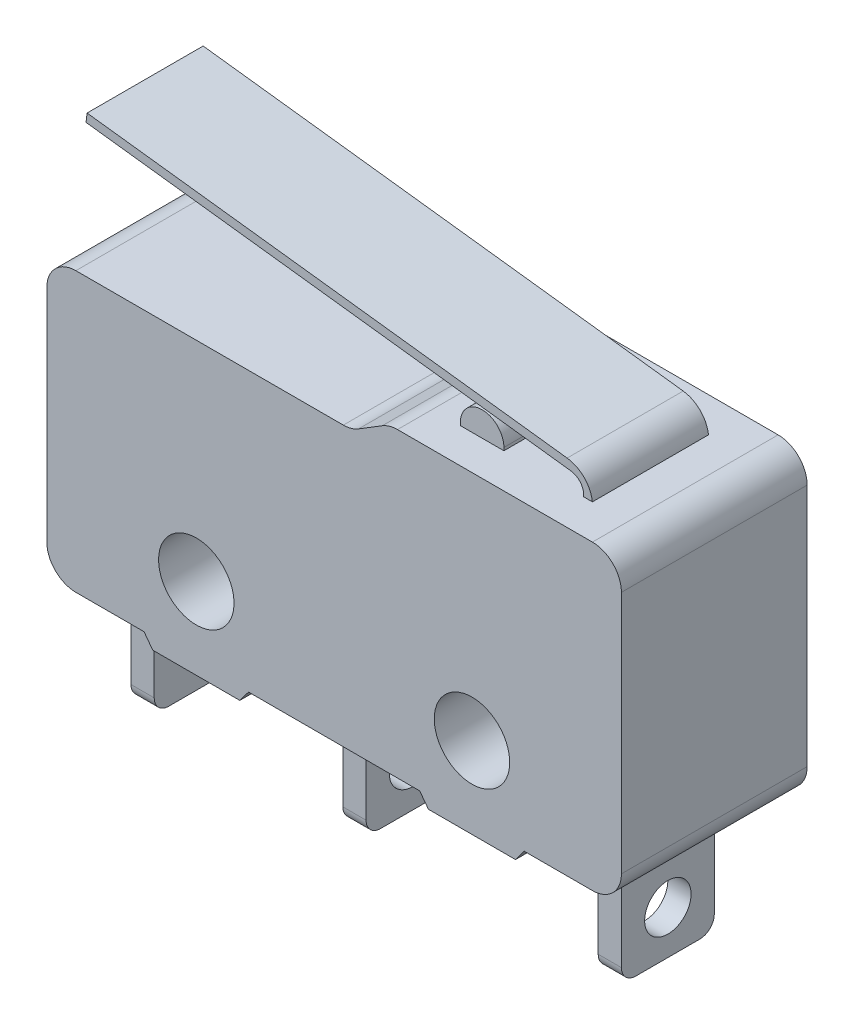
from build123d import *

# Parameters (mm, degrees)
SKETCH_1_W          = 19.8
SKETCH_1_H          = 10.4
EXTRUDE_1_DEPTH     = 6.4
SKETCH_2_R          = 1.3
CUT_EXTRUDE_1_DEPTH = 13.884486796
EXTRUDE_2_DEPTH     = 0.8
EXTRUDE_3_DEPTH     = 0.8
EXTRUDE_4_DEPTH     = 0.8
SKETCH_8_R          = 0.8
CUT_EXTRUDE_3_DEPTH = 22.33096341
CUT_EXTRUDE_4_DEPTH = 15.892279879
FILLET_3_R          = 1
EXTRUDE_5_DEPTH     = 4
EXTRUDE_10_DEPTH    = 4
FILLET_4_R          = 0.5
FILLET_5_R          = 1
FILLET_6_R          = 1
FILLET_7_R          = 1
EXTRUDE_11_DEPTH    = 6.4


with BuildPart() as part:
    # 草图1 → 凸台-拉伸1 (new body)
    with BuildSketch(Plane.XY):
        Rectangle(SKETCH_1_W, SKETCH_1_H)
    extrude(amount=EXTRUDE_1_DEPTH)

    # 草图2 → 切除-拉伸1 (cut, through all)
    with BuildSketch(Plane(origin=(0, 0, 0), x_dir=(-1, 0, 0), z_dir=(0, 0, -1))):
        with Locations((-4.75, -2.8)):
            Circle(SKETCH_2_R)
        with Locations((4.75, -2.8)):
            Circle(SKETCH_2_R)
    extrude(amount=-CUT_EXTRUDE_1_DEPTH, mode=Mode.SUBTRACT)

    # 草图5 → 凸台-拉伸2 (add)
    with BuildSketch(Plane(origin=(8.3, 0, 0), x_dir=(0, 0, -1), z_dir=(1, 0, 0))):
        with BuildLine():
            Line((-4.8, -5.2), (-1.6, -5.2))
            Line((-1.6, -5.2), (-1.6, -8.6))
            ThreePointArc((-1.6, -8.6), (-1.746446609, -8.953553391), (-2.1, -9.1))
            Line((-2.1, -9.1), (-4.3, -9.1))
            ThreePointArc((-4.3, -9.1), (-4.653553391, -8.953553391), (-4.8, -8.6))
            Line((-4.8, -8.6), (-4.8, -5.2))
        make_face()
    extrude(amount=-EXTRUDE_2_DEPTH)

    # 草图6 → 凸台-拉伸3 (add)
    with BuildSketch(Plane(origin=(-0.5, 0, 0), x_dir=(0, 0, -1), z_dir=(1, 0, 0))):
        with BuildLine():
            Line((-4.8, -5.2), (-1.6, -5.2))
            Line((-1.6, -5.2), (-1.6, -8.6))
            ThreePointArc((-1.6, -8.6), (-1.746446609, -8.953553391), (-2.1, -9.1))
            Line((-2.1, -9.1), (-4.3, -9.1))
            ThreePointArc((-4.3, -9.1), (-4.653553391, -8.953553391), (-4.8, -8.6))
            Line((-4.8, -8.6), (-4.8, -5.2))
        make_face()
    extrude(amount=-EXTRUDE_3_DEPTH)

    # 草图7 → 凸台-拉伸4 (add)
    with BuildSketch(Plane(origin=(-7.8, 0, 0), x_dir=(0, 0, -1), z_dir=(1, 0, 0))):
        with BuildLine():
            Line((-4.8, -5.2), (-1.6, -5.2))
            Line((-1.6, -5.2), (-1.6, -8.6))
            ThreePointArc((-1.6, -8.6), (-1.746446609, -8.953553391), (-2.1, -9.1))
            Line((-2.1, -9.1), (-4.3, -9.1))
            ThreePointArc((-4.3, -9.1), (-4.653553391, -8.953553391), (-4.8, -8.6))
            Line((-4.8, -8.6), (-4.8, -5.2))
        make_face()
    extrude(amount=-EXTRUDE_4_DEPTH)

    # 草图8 → 切除-拉伸3 (cut, through all)
    with BuildSketch(Plane(origin=(8.3, 0, 0), x_dir=(0, 0, -1), z_dir=(1, 0, 0))):
        with Locations(Location((-3.2, -7.6, 0), (0, 0, 180))):
            Circle(SKETCH_8_R)
    extrude(amount=-CUT_EXTRUDE_3_DEPTH, mode=Mode.SUBTRACT)

    # 草图9 → 切除-拉伸4 (cut, through all)
    with BuildSketch(Plane(origin=(0, 0, 0), x_dir=(-1, 0, 0), z_dir=(0, 0, -1))):
        Polygon((-1.9, 5.2), (-0.6, 4.4), (9.9, 4.4), (9.9, 5.2), align=None)
    extrude(amount=-CUT_EXTRUDE_4_DEPTH, mode=Mode.SUBTRACT)

    # 圆角3
    fillet_3_edges = [part.edges().sort_by_distance(p)[0] for p in [
        (1.9, 5.2, 3.2),
        (0.6, 4.4, 3.2),
    ]]
    fillet(fillet_3_edges, radius=FILLET_3_R)

    # 草图10 → 凸台-拉伸5 (add)
    with BuildSketch(Plane.XY.offset(1.2)):
        with BuildLine():
            Line((3.15, 5.2), (4.65, 5.2))
            Line((4.65, 5.2), (4.65, 5.3))
            ThreePointArc((4.65, 5.3), (3.9, 6.05), (3.15, 5.3))
            Line((3.15, 5.3), (3.15, 5.2))
        make_face()
    extrude(amount=EXTRUDE_5_DEPTH)

    # 草图12 → 凸台-拉伸10 (add)
    with BuildSketch(Plane.XY.offset(1.2)):
        Polygon((7.4, 5.2), (7.4, 5), (7.7, 5), (7.7, 5.2), (7.7, 5.965506001), (-9.713537643, 8.097775917), (-9.75, 7.8), (7.4, 5.7), align=None)
    extrude(amount=EXTRUDE_10_DEPTH)

    # 圆角4
    fillet_4_edges = [part.edges().sort_by_distance(p)[0] for p in [
        (7.4, 5.7, 3.2),
    ]]
    fillet(fillet_4_edges, radius=FILLET_4_R)

    # 圆角5
    # the kernel refuses this fillet: 1 mm, written as the material it takes off along each edge
    with BuildSketch(Plane(origin=(7.7, 5.965506001, -0.994226351), x_dir=(0, -1, 0), z_dir=(0, 0, 1))) as fillet_5_piece_1:
        with BuildLine():
            CenterArc((0.885910836, -0.992724874), FILLET_5_R, 96.915467292, 76.103475301)
            Line((-0.106675553, -0.871183684), (-0.126527281, -0.86875286))
            Line((-0.126527281, -0.86875286), (-0.019851728, 0.002430824))
            Line((-0.019851728, 0.002430824), (0, 0.02))
            ThreePointArc((0, 0.02), (0.382753001, 0.02), (0.763097904, 0.019854497))
            Line((0.763097904, 0.019854497), (0.765506001, 0))
        make_face()
    extrude(amount=8.388452701, mode=Mode.SUBTRACT)

    # 圆角6
    fillet_6_edges = [part.edges().sort_by_distance(p)[0] for p in [
        (9.9, -5.2, 3.2),
        (-9.9, -5.2, 3.2),
    ]]
    fillet(fillet_6_edges, radius=FILLET_6_R)

    # 圆角7
    fillet_7_edges = [part.edges().sort_by_distance(p)[0] for p in [
        (9.9, 5.2, 3.2),
        (-9.9, 4.4, 3.2),
    ]]
    fillet(fillet_7_edges, radius=FILLET_7_R)

    # 草图13 → 凸台-拉伸11 (add)
    with BuildSketch(Plane.XY.offset(6.4)):
        Polygon((-6.55, -5.2), (-6.25, -5.6), (-3.25, -5.6), (-2.95, -5.2), align=None)
        Polygon((6.25, -5.6), (3.25, -5.6), (2.95, -5.2), (6.55, -5.2), align=None)
    extrude(amount=-EXTRUDE_11_DEPTH)


solid = part.part
